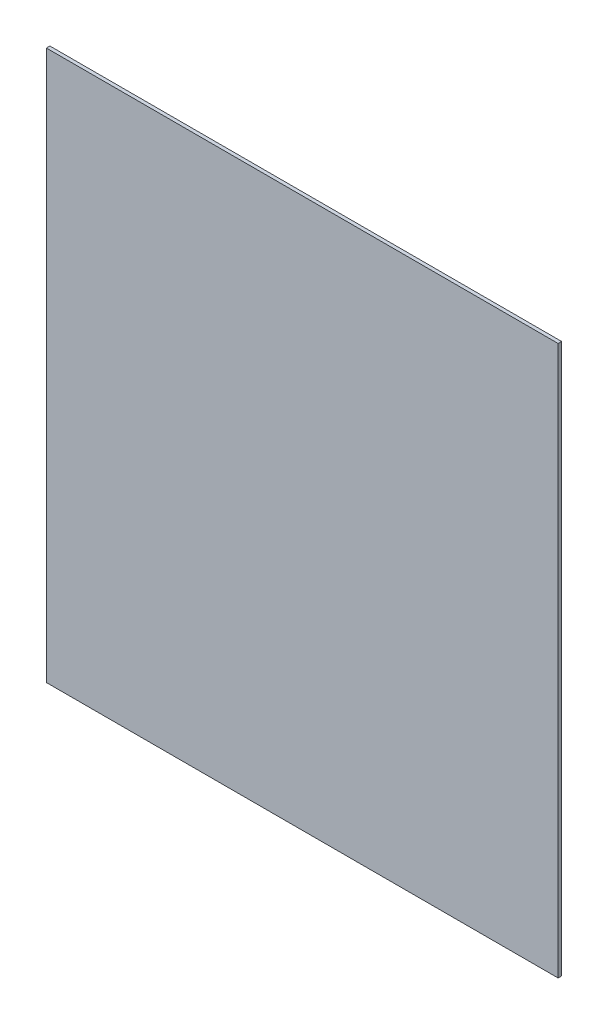
from build123d import *

# Parameters (mm, degrees)
SKETCH1_W           = 437.65
SKETCH1_H           = 470
BOSS_EXTRUDE1_DEPTH = 3


with BuildPart() as part:
    # Sketch1 → Boss-Extrude1 (new body)
    with BuildSketch(Plane.XY):
        with Locations((218.825, 235)):
            Rectangle(SKETCH1_W, SKETCH1_H)
    extrude(amount=BOSS_EXTRUDE1_DEPTH)


solid = part.part
